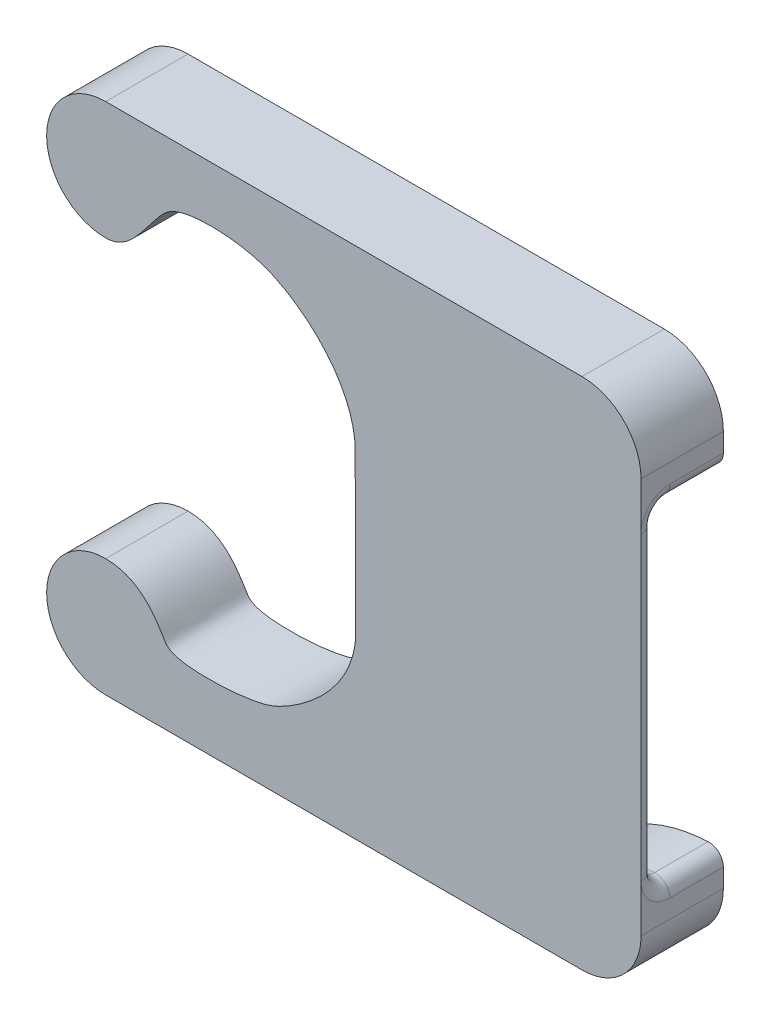
from build123d import *

# Parameters (mm, degrees)
BOSS_EXTRUDE1_DEPTH = 20
CUT_EXTRUDE1_DEPTH  = 16.5
FILLET3_START       = -1
FILLET3_DEPTH       = 17.5
FILLET4_R           = 3.5


with BuildPart() as part:
    # Sketch1 → Boss-Extrude1 (new body)
    with BuildSketch(Plane.XY):
        with BuildLine():
            ThreePointArc((-131.259630673, -52.419279953), (-127.051938083, -62.566715693), (-116.89990657, -66.763307783))
            add(Edge.make_bspline(
                [(-116.89990657, -66.763307783), (-110.9642352, -66.791206459), (-106.833903486, -58.347645362), (-98.785324044, -50.744043542), (-82.867920051, -51.145231197), (-65.120488891, -59.494445993), (-56.313225772, -71.180138293), (-56.294671693, -81.068426017)],
                knots=[0, 0, 0, 0, 0.282748193, 0.340252923, 0.548959038, 0.617542573, 1, 1, 1, 1], degree=3))
            Line((-56.294671693, -81.068426017), (-56.182067659, -120.043654507))
            ThreePointArc((-56.182067659, -120.043654507), (-56.273685166, -121.514957168), (-56.515795396, -122.969091936))
            add(Edge.make_bspline(
                [(-116.90384339, -134.235842911), (-109.22527777, -134.309412061), (-104.745159971, -140.500157674), (-100.683849816, -147.695001914), (-83.705855967, -147.244039534), (-72.475353768, -143.923014022), (-58.590386126, -134.04906882), (-56.515795396, -122.969091936)],
                knots=[0, 0, 0, 0, 0.429005653, 0.50737942, 0.753031194, 0.805363899, 0.984626937, 0.984626937, 0.984626937, 0.984626937], degree=3))
            ThreePointArc((-116.90384339, -134.235842911), (-127.053465173, -138.43496232), (-131.259630181, -148.58166632))
            ThreePointArc((-131.259630181, -148.58166632), (-127.057558867, -158.730066333), (-116.909631905, -162.933279928))
            Line((-116.909631905, -162.933279928), (-1.187082188, -162.933279873))
            ThreePointArc((-1.187082188, -162.933279873), (8.959415741, -158.729939309), (13.162366697, -148.583279988))
            Line((13.162366697, -148.583279988), (13.162366532, -52.42087541))
            ThreePointArc((13.162366532, -52.42087541), (8.960283941, -42.27249138), (-1.187633214, -38.069281426))
            Line((-1.187633214, -38.069281426), (-116.905872237, -38.069282363))
            ThreePointArc((-116.905872237, -38.069282363), (-127.056157939, -42.270095404), (-131.259630673, -52.419279953))
        make_face()
    extrude(amount=BOSS_EXTRUDE1_DEPTH)

    # Sketch2 → Cut-Extrude1 (cut)
    with BuildSketch(Plane(origin=(0, 0, 0), x_dir=(-1, 0, 0), z_dir=(0, 0, -1))):
        with BuildLine():
            ThreePointArc((41.277633269, -75.522379927), (32.495107447, -58.964352477), (13.860805963, -56.94845539))
            add(Edge.make_bspline(
                [(13.860805963, -56.94845539), (6.380204797, -59.916973374), (5.110003511, -60.502077699), (-13.162366614, -60.502077699)],
                knots=[0, 0, 0, 0, 1, 1, 1, 1], degree=3))
            Line((-13.162366614, -60.502077699), (-13.162366614, -140.502077699))
            add(Edge.make_bspline(
                [(16.754929006, -149.066573391), (7.866770087, -147.255502293), (4.277742609, -140.502077699), (-13.162366614, -140.502077699)],
                knots=[0, 0, 0, 0, 1, 1, 1, 1], degree=3))
            ThreePointArc((16.754929006, -149.066573391), (33.718411217, -145.244381671), (41.277633175, -129.584654927))
            Line((41.277633175, -129.584654927), (41.277633269, -75.522379927))
        make_face()
    extrude(amount=-CUT_EXTRUDE1_DEPTH, mode=Mode.SUBTRACT)

    # Fillet3: read off the stored shape, not the designer's step
    # Fillet3 outline → Fillet3 (cut)
    with BuildSketch(Plane.XY.offset(FILLET3_START)):
        with BuildLine():
            ThreePointArc((-16.754929006, -149.066573391), (-16.877587335, -149.094642027), (-17.000419827, -149.121938413))
            ThreePointArc((-17.000419827, -149.121938413), (-16.75205364, -149.067709754), (-16.503627143, -149.013758055))
            add(Edge.make_bspline(
                [(-16.754929006, -149.066573391), (-16.670691165, -149.0494089), (-16.586929312, -149.031800469), (-16.503627143, -149.013758055)],
                knots=[0, 0, 0, 0, 0.009477535, 0.009477535, 0.009477535, 0.009477535], degree=3))
        make_face()
    extrude(amount=FILLET3_DEPTH, mode=Mode.SUBTRACT)

    # Fillet4
    fillet4_edges = [part.edges().sort_by_distance(p)[0] for p in [
        (-41.277633222, -102.553517427, 16.5),
        (-32.495107447, -58.964352477, 16.5),
        (13.162366614, -60.502077699, 8.25),
        (13.162366614, -100.502077699, 16.5),
        (13.162366614, -140.502077699, 8.25),
        (-33.816686828, -145.165801659, 16.5),
        (-4.883888448, -144.050795082, 16.5),
        (-4.396133034, -59.838460788, 16.5),
        (-16.75205364, -149.067709754, 16.5),
    ]]
    fillet(fillet4_edges, radius=FILLET4_R - 0.0001)  # a hair under: the kernel refuses the full size


solid = part.part
